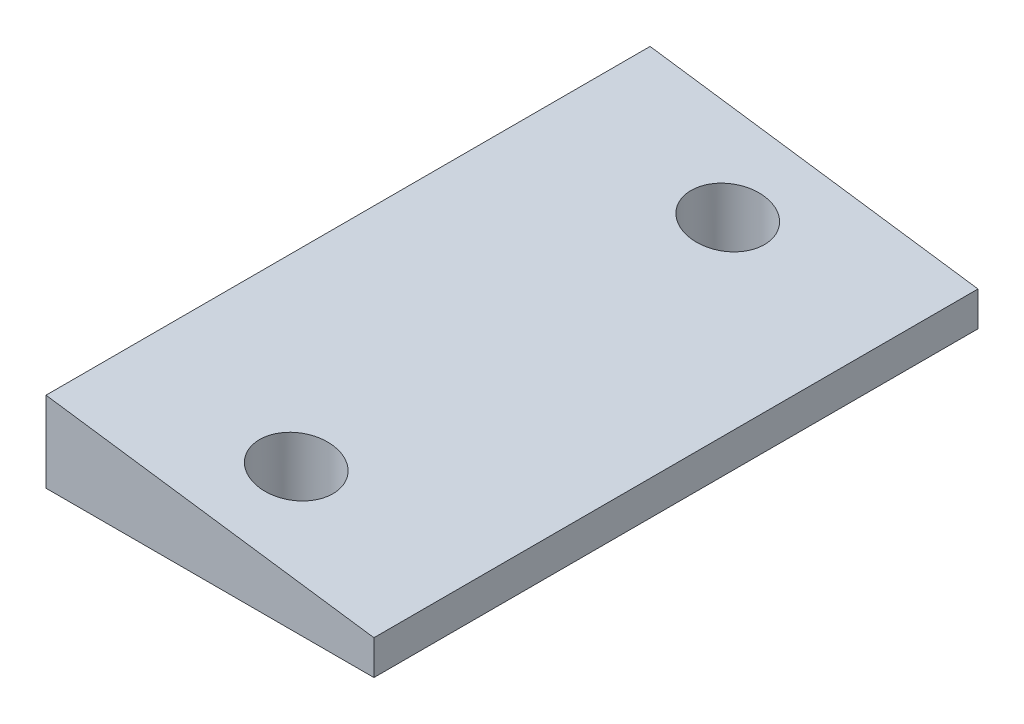
from build123d import *

# Parameters (mm, degrees)
DODANIE_WYCI_GNI_CIE1_DEPTH = 70
SZKIC2_R                    = 4.25
WYTNIJ_WYCI_GNI_CIE1_DEPTH  = 10


with BuildPart() as part:
    # Szkic1 → Dodanie-wyciągnięcie1 (new body)
    with BuildSketch(Plane.XY):
        Polygon((-16.558198873, 5.237130444), (-16.558198873, -4.103421275), (21.441801127, -4.103421275), (21.441801127, -0.103421275), align=None)
    extrude(amount=DODANIE_WYCI_GNI_CIE1_DEPTH)

    # Szkic2 → Wytnij-wyciągnięcie1 (cut)
    with BuildSketch(Plane(origin=(0, 5.237130444, 0), x_dir=(-1, 0, 0), z_dir=(0, -1, 0))):
        with Locations((-2.441801127, -60)):
            Circle(SZKIC2_R)
        with Locations((-2.441801127, -10)):
            Circle(SZKIC2_R)
    extrude(amount=WYTNIJ_WYCI_GNI_CIE1_DEPTH, mode=Mode.SUBTRACT)


solid = part.part
